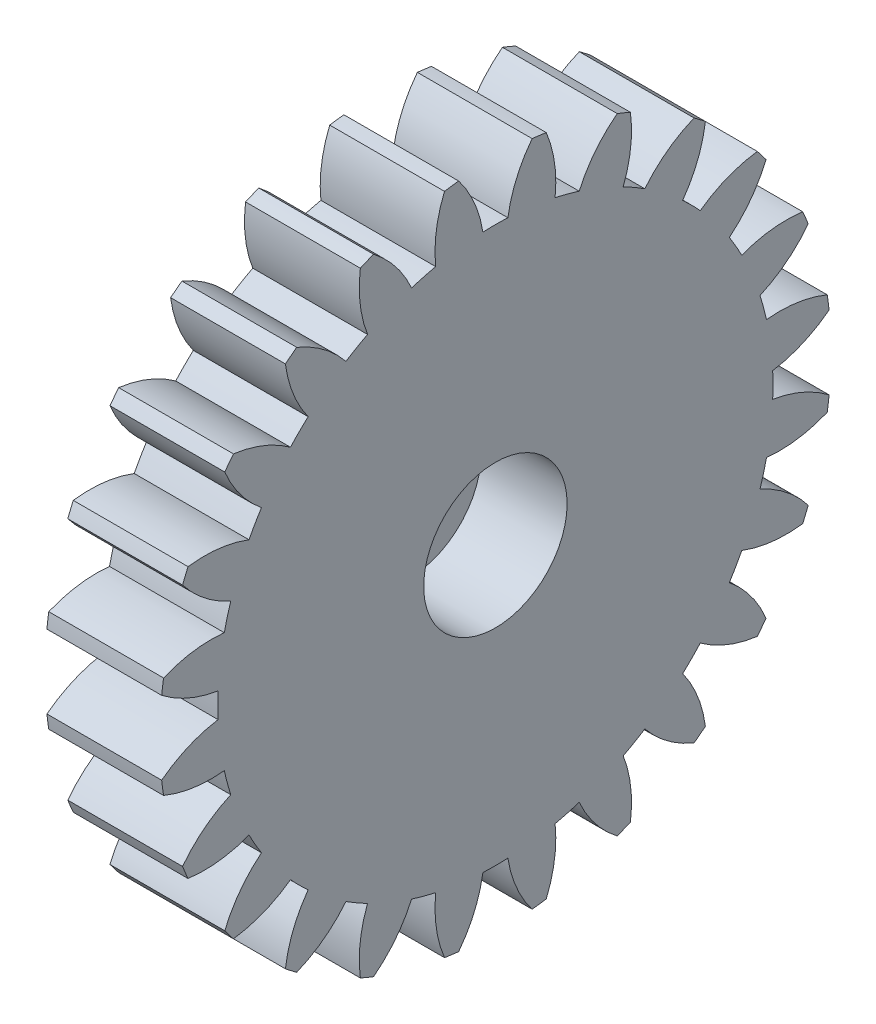
from build123d import *

# Parameters (mm, degrees)
BASPROSKE_W        = 4
BASPROSKE_H        = 11.7
TOOTHCUT_DEPTH     = 18.022925718
TEETHCUTS_COUNT    = 24
TEETHCUTS_ANGLE    = 345
BORSKE_R           = 1
BORE_DEPTH         = 50.0000508
SKETCH1_R          = 2.5
CUT_EXTRUDE1_DEPTH = 3


with BuildPart() as part:
    # BasProSke → Base-Revolve (revolve)
    with BuildSketch(Plane(origin=(0, 0, 0), x_dir=(1, 0, 0), z_dir=(0, 1, 0))):
        with Locations((2, 5.85)):
            Rectangle(BASPROSKE_W, BASPROSKE_H)
    revolve(axis=Axis((-10, 0, 0), (1, 0, 0)))

    # TooCutSke → ToothCut (cut, through all)
    with BuildSketch(Plane(origin=(0, 0, 0), x_dir=(0, 0, -1), z_dir=(1, 0, 0))):
        with BuildLine():
            ThreePointArc((0.434774164, 9.664225133), (0, 9.674), (-0.434774164, 9.664225133))
            ThreePointArc((-0.434774164, 9.664225133), (-0.739698742, 10.71382507), (-1.298287656, 11.653302293))
            ThreePointArc((-1.298287656, 11.653302293), (0, 11.7254), (1.298287656, 11.653302293))
            ThreePointArc((1.298287656, 11.653302293), (0.739698742, 10.71382507), (0.434774164, 9.664225133))
        make_face()
    toothcut = extrude(amount=TOOTHCUT_DEPTH, mode=Mode.SUBTRACT)

    # TeethCuts: ToothCut ×24 about axis
    teethcuts_axis = Axis((-10, 0, 0), (1, 0, 0))
    for i in range(1, TEETHCUTS_COUNT):
        add(toothcut.rotate(teethcuts_axis, i * TEETHCUTS_ANGLE / (TEETHCUTS_COUNT - 1)), mode=Mode.SUBTRACT)

    # BorSke → Bore (cut, symmetric)
    with BuildSketch(Plane(origin=(0, 0, 0), x_dir=(0, 0, -1), z_dir=(1, 0, 0))):
        Circle(BORSKE_R)
    extrude(amount=BORE_DEPTH, both=True, mode=Mode.SUBTRACT)

    # Sketch1 → Cut-Extrude1 (cut)
    with BuildSketch(Plane(origin=(4, 0, 0), x_dir=(0, 0, -1), z_dir=(1, 0, 0))):
        Circle(SKETCH1_R)
    extrude(amount=-CUT_EXTRUDE1_DEPTH, mode=Mode.SUBTRACT)


solid = part.part
